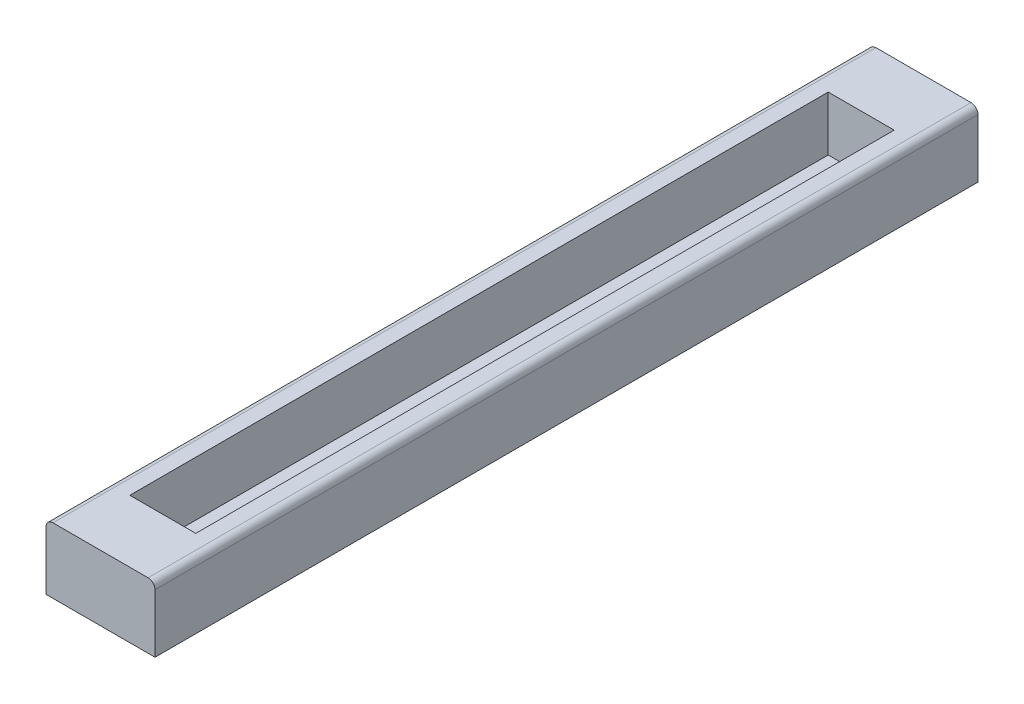
from build123d import *

# Parameters (mm, degrees)
SKETCH1_W           = 2
SKETCH1_H           = 15.1
BOSS_EXTRUDE1_DEPTH = 1.2
SKETCH2_W           = 1.21
SKETCH2_H           = 12.814
CUT_EXTRUDE1_DEPTH  = 1
FILLET1_R           = 0.127


with BuildPart() as part:
    # Sketch1 → Boss-Extrude1 (new body)
    with BuildSketch(Plane(origin=(0, 1.2, 0), x_dir=(-1, 0, 0), z_dir=(0, 1, 0))):
        Rectangle(SKETCH1_W, SKETCH1_H)
    extrude(amount=-BOSS_EXTRUDE1_DEPTH)

    # Sketch2 → Cut-Extrude1 (cut)
    with BuildSketch(Plane(origin=(0, 1.2, 0), x_dir=(-1, 0, 0), z_dir=(0, 1, 0))):
        Rectangle(SKETCH2_W, SKETCH2_H)
    extrude(amount=-CUT_EXTRUDE1_DEPTH, mode=Mode.SUBTRACT)

    # Fillet1
    fillet1_edges = [part.edges().sort_by_distance(p)[0] for p in [
        (1, 1.2, 0),
        (-1, 1.2, 0),
    ]]
    fillet(fillet1_edges, radius=FILLET1_R)


solid = part.part
